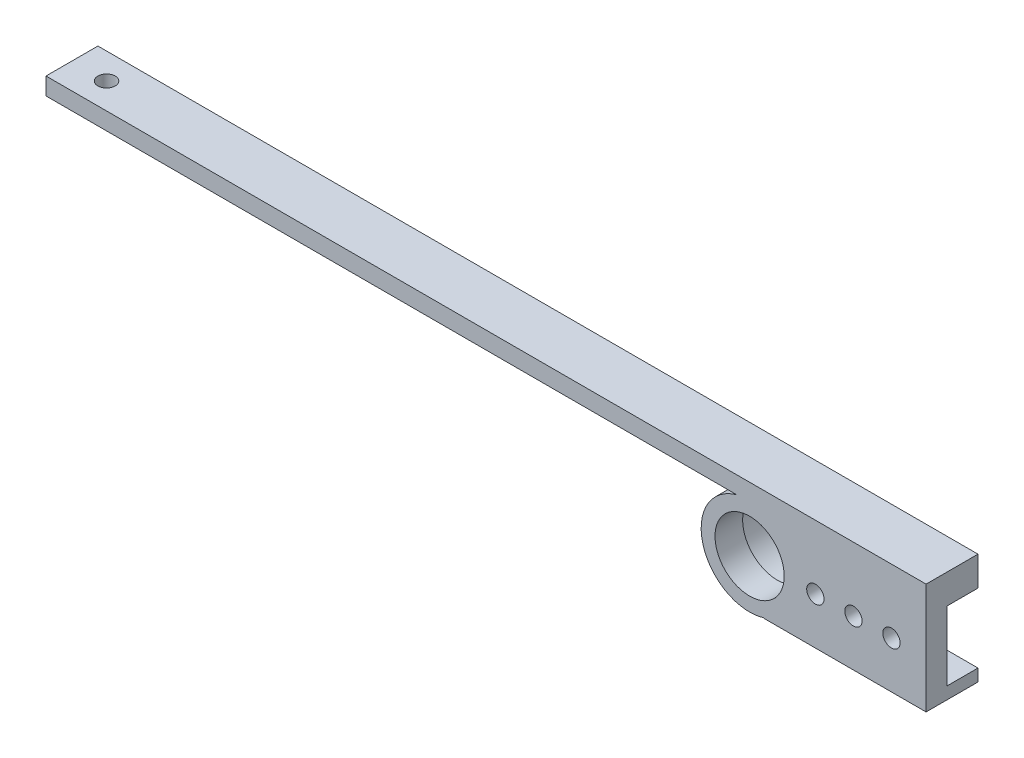
from build123d import *

# Parameters (mm, degrees)
SKETCH_1_W          = 40
SKETCH_1_H          = 20
EXTRUDE_1_DEPTH     = 6
SKETCH_2_R          = 2.5
CUT_EXTRUDE_1_DEPTH = 24.151673806
EXTRUDE_START       = -15
EXTRUDE_2_OUTLINE_R = 11
EXTRUDE_2_DEPTH     = 15
EXTRUDE_START_2     = -8
SKETCH_5_R          = 11
SKETCH_5_R_2        = 10
EXTRUDE_3_DEPTH     = 8
SKETCH_8_W          = 15
SKETCH_8_H          = 5
EXTRUDE_4_DEPTH     = 500
SKETCH_9_W          = 4.037306924
SKETCH_9_H          = 3.364422437
EXTRUDE_5_DEPTH     = 15
SKETCH_11_W         = 261.320344598
SKETCH_11_H         = 37.265148186
CUT_EXTRUDE_2_DEPTH = 482.183177179
SKETCH_12_R         = 2.5
CUT_EXTRUDE_3_DEPTH = 237.730557242


# Read off the part's stored shape, not the designer's step: 凸台-拉伸2
with BuildPart() as part:
    # 草图1 → 凸台-拉伸1 (new body)
    with BuildSketch(Plane.XY):
        Rectangle(SKETCH_1_W, SKETCH_1_H)
    extrude(amount=EXTRUDE_1_DEPTH)

    # 草图2 → 切除-拉伸1 (cut, through all)
    with BuildSketch(Plane.XY.offset(6)):
        with Locations((10, 0)):
            Circle(SKETCH_2_R)
        with Locations((-1, 0)):
            Circle(SKETCH_2_R)
        with Locations((-12, 0)):
            Circle(SKETCH_2_R)
    extrude(amount=-CUT_EXTRUDE_1_DEPTH, mode=Mode.SUBTRACT)

    # 凸台-拉伸2 outline → 凸台-拉伸2 (add)
    with BuildSketch(Plane.XY.offset(6).offset(EXTRUDE_START)):
        with BuildLine():
            Line((20, 10), (20, 13.5))
            Line((20, 13.5), (-26.893967141, 13.5))
            Line((-26.893967141, 13.5), (-26.893967141, 13.384337644))
            ThreePointArc((-26.893967141, 13.384337644), (-45, 0), (-26.893967141, -13.384337644))
            Line((-26.893967141, -13.384337644), (-26.893967141, -13.5))
            Line((-26.893967141, -13.5), (20, -13.5))
            Line((20, -13.5), (20, -10))
            Line((20, -10), (-20, -10))
            Line((-20, -10), (-20, -8.660254038))
            ThreePointArc((-20, -8.660254038), (-17, 0), (-20, 8.660254038))
            Line((-20, 8.660254038), (-20, 10))
            Line((-20, 10), (20, 10))
        make_face()
        with Locations((-31, 0)):
            Circle(EXTRUDE_2_OUTLINE_R, mode=Mode.SUBTRACT)
    extrude(amount=EXTRUDE_2_DEPTH)

    # 草图5 → 凸台-拉伸3 (add)
    with BuildSketch(Plane.XY.offset(6).offset(EXTRUDE_START_2)):
        with Locations((-31, 0)):
            Circle(SKETCH_5_R)
        with Locations((-31, 0)):
            Circle(SKETCH_5_R_2, mode=Mode.SUBTRACT)
    extrude(amount=EXTRUDE_3_DEPTH)

    # 草图8 → 凸台-拉伸4 (add)
    with BuildSketch(Plane(origin=(20, 0, 0), x_dir=(0, 0, -1), z_dir=(1, 0, 0))):
        with Locations((1.5, 16)):
            Rectangle(SKETCH_8_W, SKETCH_8_H)
    extrude(amount=-EXTRUDE_4_DEPTH)

    # 草图9 → 凸台-拉伸5 (add, through all)
    with BuildSketch(Plane(origin=(0, 0, -9), x_dir=(-1, 0, 0), z_dir=(0, 0, -1))):
        with Locations((26.475334378, 14.151164675)):
            Rectangle(SKETCH_9_W, SKETCH_9_H)
    extrude(amount=-EXTRUDE_5_DEPTH)

    # 草图11 → 切除-拉伸2 (cut, through all)
    with BuildSketch(Plane(origin=(0, 18.5, 0), x_dir=(1, 0, 0), z_dir=(0, 1, 0))):
        with Locations((-364.976425965, 6.732710128)):
            Rectangle(SKETCH_11_W, SKETCH_11_H)
    extrude(amount=-CUT_EXTRUDE_2_DEPTH, mode=Mode.SUBTRACT)

    # 草图12 → 切除-拉伸3 (cut, through all)
    with BuildSketch(Plane(origin=(0, 18.5, 0), x_dir=(1, 0, 0), z_dir=(0, 1, 0))):
        with Locations(Location((-224.316253666, 1.5, 0), (0, 0, 270))):
            Circle(SKETCH_12_R)
    extrude(amount=-CUT_EXTRUDE_3_DEPTH, mode=Mode.SUBTRACT)


solid = part.part
